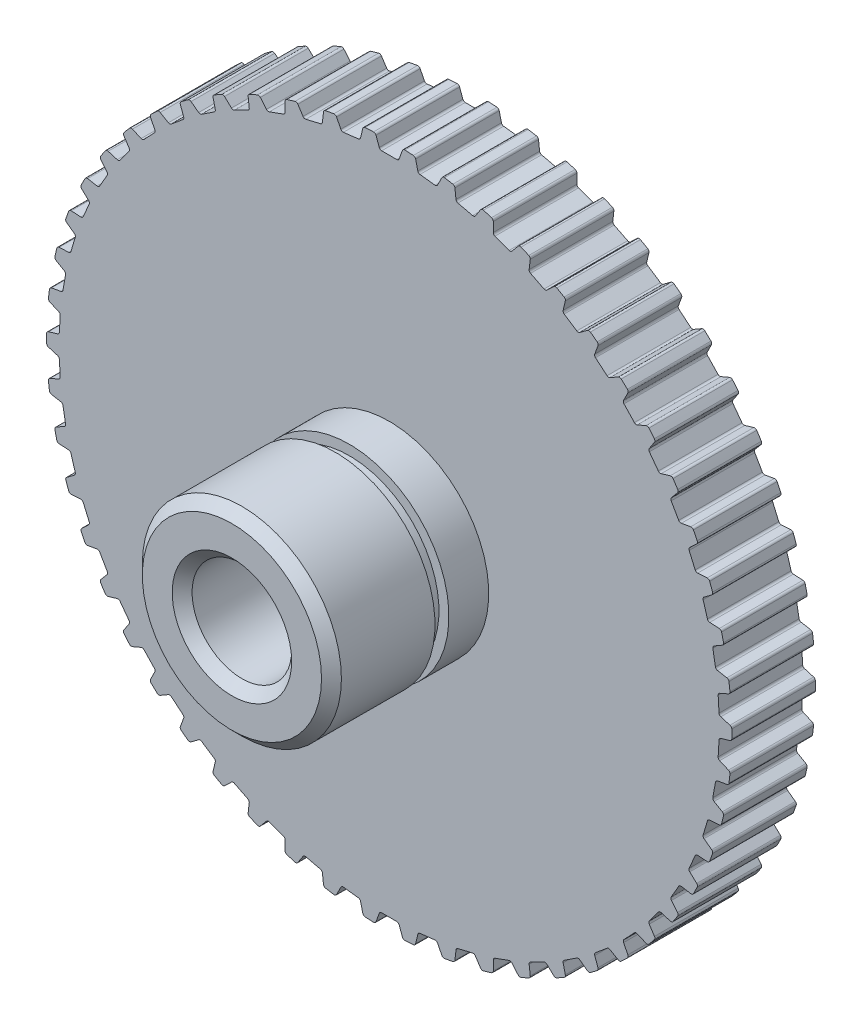
from build123d import *
from build123d.topology import SkipClean

# Parameters (mm, degrees)
GEARBELT_BASESKETCH_W  = 6
GEARBELT_BASESKETCH_H  = 17.2097536
TOOTH_EXTRUDE_START    = -2.1
TOOTH_EXTRUDE_DEPTH    = 4.2
TOOTH_PATTERN_18_COUNT = 54
SKETCH4_R              = 5
EXTRUDE_890_DEPTH      = 7
BOSS_EXTRUDE3_START    = 8
SKETCH8_R              = 5
BOSS_EXTRUDE3_DEPTH    = 8
SKETCH6_R              = 1.65
CUT_EXTRUDE_1128_DEPTH = 5
SKETCH5_R              = 2.5
CUT_EXTRUDE4_DEPTH     = 23
CHAMFER1_SIZE          = 0.5
CHAMFER3_SIZE          = 1
CHAMFER3_SIZE2         = 1.732050808


with BuildPart() as part:
    # GearBelt-BaseSketch → 0.080in Pitch 'MXL', 0.125in Belt Width, 11,6425mm P.D. (revolve)
    with BuildSketch(Plane(origin=(0, 0, 0), x_dir=(0, 0, -1), z_dir=(1, 0, 0)), mode=Mode.PRIVATE) as f_0_080in_pitch_mxl_0_125in_belt_width_sk:
        with Locations((0, 8.6048768)):
            Rectangle(GEARBELT_BASESKETCH_W, GEARBELT_BASESKETCH_H)
    revolve(f_0_080in_pitch_mxl_0_125in_belt_width_sk.sketch.rotate(Axis((0, 0, 3.048), (0, 0, -1)), 90), axis=Axis((0, 0, 3.048), (0, 0, -1)))

    # Tooth-Sketch → Tooth-Extrude (cut)
    with BuildSketch(Plane.XY.offset(TOOTH_EXTRUDE_START)):
        with BuildLine():
            Line((-0.379703626, 16.574753605), (0.379703626, 16.574753605))
            ThreePointArc((0.379703626, 16.574753605), (0.452547836, 16.597721296), (0.499044593, 16.65831705))
            Line((0.499044593, 16.65831705), (0.662815787, 17.108274709))
            ThreePointArc((0.662815787, 17.108274709), (0.7117139, 17.170511256), (0.787971619, 17.191704963))
            Line((0.787971619, 17.191704963), (0.787971619, 19.731704963))
            Line((0.787971619, 19.731704963), (-0.787971619, 19.731704963))
            Line((-0.787971619, 19.731704963), (-0.787971619, 17.191704963))
            ThreePointArc((-0.787971619, 17.191704963), (-0.7117139, 17.170511256), (-0.662815787, 17.108274709))
            Line((-0.662815787, 17.108274709), (-0.499044593, 16.65831705))
            ThreePointArc((-0.499044593, 16.65831705), (-0.452547836, 16.597721296), (-0.379703626, 16.574753605))
        make_face()
    tooth_extrude = extrude(amount=TOOTH_EXTRUDE_DEPTH, mode=Mode.SUBTRACT)

    # Tooth Pattern, 18: Tooth-Extrude ×54 about axis
    tooth_pattern_18_axis = Axis((0, 0, 0), (0, 0, 1))
    for i in range(1, TOOTH_PATTERN_18_COUNT):
        add(tooth_extrude.rotate(tooth_pattern_18_axis, i * 360 / TOOTH_PATTERN_18_COUNT), mode=Mode.SUBTRACT)

    # Sketch4 → Extrude 890 (add)
    with BuildSketch(Plane.XY.offset(3)):
        with Locations(Location((0, 0, 0), (0, 0, 180))):
            Circle(SKETCH4_R)
    extrude(amount=EXTRUDE_890_DEPTH)

    # Sketch8 → Boss-Extrude3 (add)
    with BuildSketch(Plane(origin=(0, 0, -3), x_dir=(-1, 0, 0), z_dir=(0, 0, -1)).offset(BOSS_EXTRUDE3_START)):
        Circle(SKETCH8_R)
    extrude(amount=-BOSS_EXTRUDE3_DEPTH)

    # Sketch6 → Cut-Extrude 1128 (cut)
    with BuildSketch(Plane.ZY.offset(5)):
        with Locations((-7.5, 0)):
            Circle(SKETCH6_R)
    extrude(amount=-CUT_EXTRUDE_1128_DEPTH, mode=Mode.SUBTRACT)

    # Sketch5 → Cut-Extrude4 (cut)
    with BuildSketch(Plane.XY.offset(10)):
        Circle(SKETCH5_R)
    extrude(amount=-CUT_EXTRUDE4_DEPTH, mode=Mode.SUBTRACT)

    # Chamfer1
    chamfer1_edges = [part.edges().sort_by_distance(p)[0] for p in [
        (5, 0, 10),
        (-2.5, 0, 10),
    ]]
    chamfer(chamfer1_edges, length=CHAMFER1_SIZE)

    # Chamfer3
    chamfer3_edges = [part.edges().sort_by_distance(p)[0] for p in [
        (5, 0, -11),
    ]]
    chamfer3_side = [part.faces().sort_by_distance(p)[0] for p in [
        (5, 0, -7),
    ]]
    chamfer(chamfer3_edges, length=CHAMFER3_SIZE, length2=CHAMFER3_SIZE2, reference=chamfer3_side[0])

    # Sketch10 → Cut-Revolve2 (revolve, cut)
    with BuildSketch(Plane(origin=(0, 0, 0), x_dir=(0, 0, 1), z_dir=(1, 0, 0)), mode=Mode.PRIVATE) as cut_revolve2_sk:
        Polygon((-2.1, 20), (-2.1, 5), (-4.1, 5), (-4.1, 4.5), (-4.8, 4.5), (-4.8, 5), (-4.8, 20), align=None)
    cut_revolve2 = revolve(cut_revolve2_sk.sketch.rotate(Axis((0, 0, -15.590292469), (0, 0, 1)), 90), axis=Axis((0, 0, -15.590292469), (0, 0, 1)), mode=Mode.SUBTRACT)

    # Mirror1: Cut-Revolve2 across plane
    with SkipClean():  # the faces are left unmerged after this step: merging them gives an invalid solid
        add(cut_revolve2.mirror(Plane(origin=(0, 0, 0), x_dir=(1, 0, 0), z_dir=(0, 0, -1))), mode=Mode.SUBTRACT)


solid = part.part
